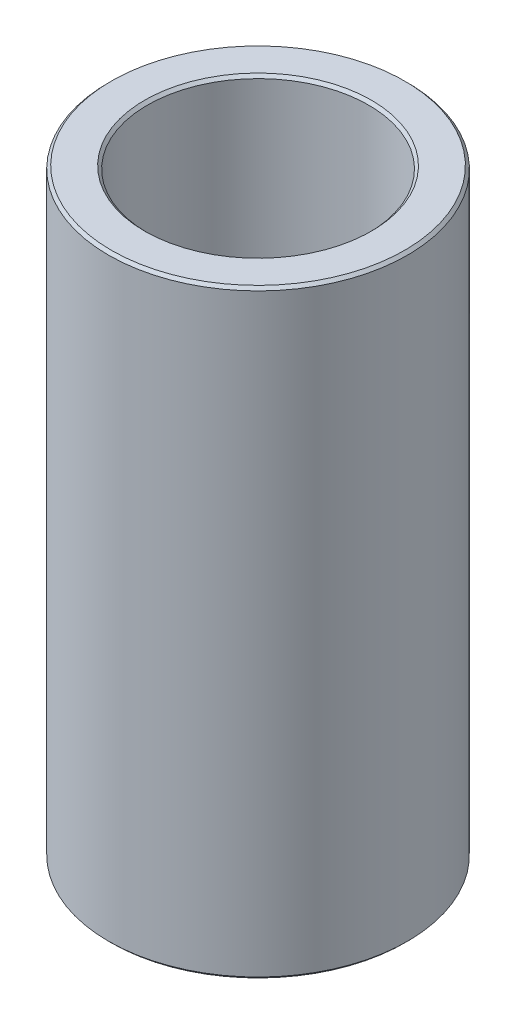
from build123d import *

# Parameters (mm, degrees)
SKETCH1_R           = 47.5
BOSS_EXTRUDE1_DEPTH = 190.638783322
SKETCH2_R           = 35.161217007
CUT_EXTRUDE1_DEPTH  = 203.127795483
CHAMFER1_SIZE       = 0.894963015


with BuildPart() as part:
    # Sketch1 → Boss-Extrude1 (new body)
    with BuildSketch(Plane(origin=(0, 0, 0), x_dir=(1, 0, 0), z_dir=(0, 1, 0))):
        Circle(SKETCH1_R)
    extrude(amount=BOSS_EXTRUDE1_DEPTH)

    # Sketch2 → Cut-Extrude1 (cut, through all)
    with BuildSketch(Plane(origin=(0, 0, 0), x_dir=(1, 0, 0), z_dir=(0, 1, 0))):
        Circle(SKETCH2_R)
    extrude(amount=CUT_EXTRUDE1_DEPTH, mode=Mode.SUBTRACT)

    # Chamfer1
    chamfer1_edges = [part.edges().sort_by_distance(p)[0] for p in [
        (-35.161217007, 190.638783322, 0),
        (-35.161217007, 0, 0),
        (-47.5, 0, 0),
        (-47.5, 190.638783322, 0),
    ]]
    chamfer(chamfer1_edges, length=CHAMFER1_SIZE)


solid = part.part
